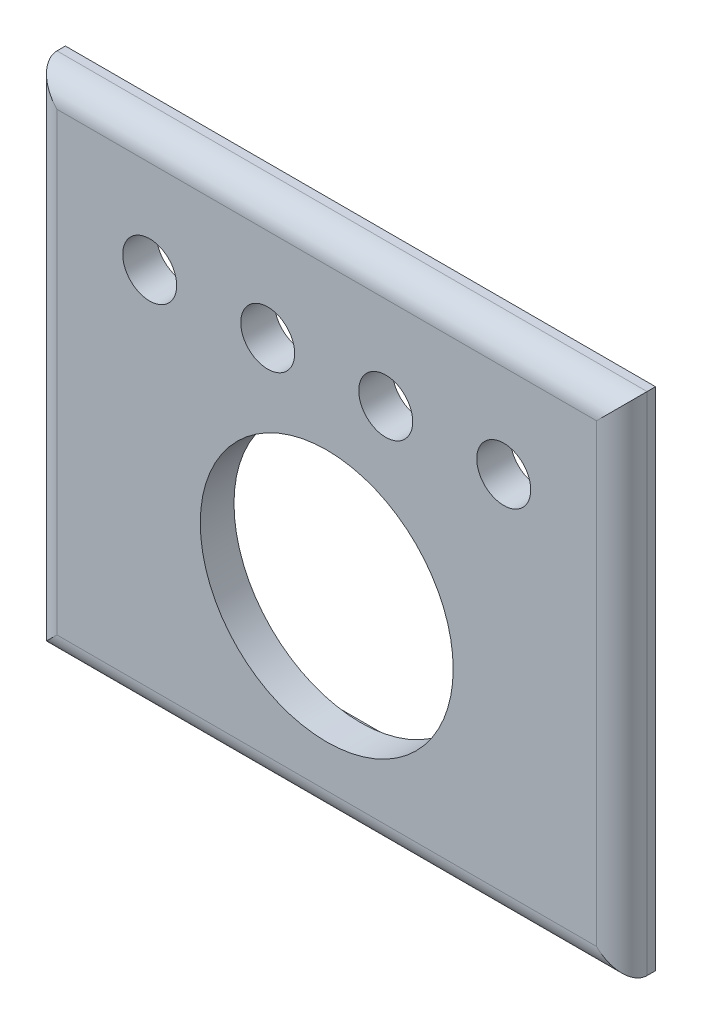
from build123d import *

# Parameters (mm, degrees)
SKETCH1_W           = 70
SKETCH1_H           = 60
BOSS_EXTRUDE1_DEPTH = 4
SKETCH2_W           = 63.6
SKETCH2_H           = 53.6
SKETCH2_W_2         = 57.6
SKETCH2_H_2         = 47.6
BOSS_EXTRUDE2_DEPTH = 2
CHAMFER1_SIZE       = 0.5
CHAMFER1_SIZE2      = 1.37373871
FILLET1_R           = 3
SKETCH3_R           = 3.2
CUT_EXTRUDE1_DEPTH  = 47.486557197
SKETCH4_R           = 15
CUT_EXTRUDE2_DEPTH  = 47.486557197


with BuildPart() as part:
    # Sketch1 → Boss-Extrude1 (new body)
    with BuildSketch(Plane.XY):
        Rectangle(SKETCH1_W, SKETCH1_H)
    extrude(amount=BOSS_EXTRUDE1_DEPTH)

    # Sketch2 → Boss-Extrude2 (add)
    with BuildSketch(Plane(origin=(0, 0, 0), x_dir=(-1, 0, 0), z_dir=(0, 0, -1))):
        Rectangle(SKETCH2_W, SKETCH2_H)
        Rectangle(SKETCH2_W_2, SKETCH2_H_2, mode=Mode.SUBTRACT)
    extrude(amount=BOSS_EXTRUDE2_DEPTH)

    # Chamfer1
    chamfer1_edges = [part.edges().sort_by_distance(p)[0] for p in [
        (-31.8, 0, -2),
        (0, 26.8, -2),
        (31.8, 0, -2),
        (0, -26.8, -2),
    ]]
    chamfer1_side = [part.faces().sort_by_distance(p)[0] for p in [
        (0, 25.968259656, -2),
    ]]
    chamfer(chamfer1_edges, length=CHAMFER1_SIZE, length2=CHAMFER1_SIZE2, reference=chamfer1_side[0])

    # Fillet1
    fillet1_edges = [part.edges().sort_by_distance(p)[0] for p in [
        (0, 30, 4),
        (35, 0, 4),
        (0, -30, 4),
        (-35, 0, 4),
    ]]
    fillet(fillet1_edges, radius=FILLET1_R)

    # Sketch3 → Cut-Extrude1 (cut, through all)
    with BuildSketch(Plane.XY.offset(4)):
        with Locations((-21, 16)):
            Circle(SKETCH3_R)
        with Locations((-7, 16)):
            Circle(SKETCH3_R)
        with Locations((7, 16)):
            Circle(SKETCH3_R)
        with Locations((21, 16)):
            Circle(SKETCH3_R)
    extrude(amount=-CUT_EXTRUDE1_DEPTH, mode=Mode.SUBTRACT)

    # Sketch4 → Cut-Extrude2 (cut, through all)
    with BuildSketch(Plane.XY.offset(4)):
        with Locations((0, -7)):
            Circle(SKETCH4_R)
    extrude(amount=-CUT_EXTRUDE2_DEPTH, mode=Mode.SUBTRACT)


solid = part.part
